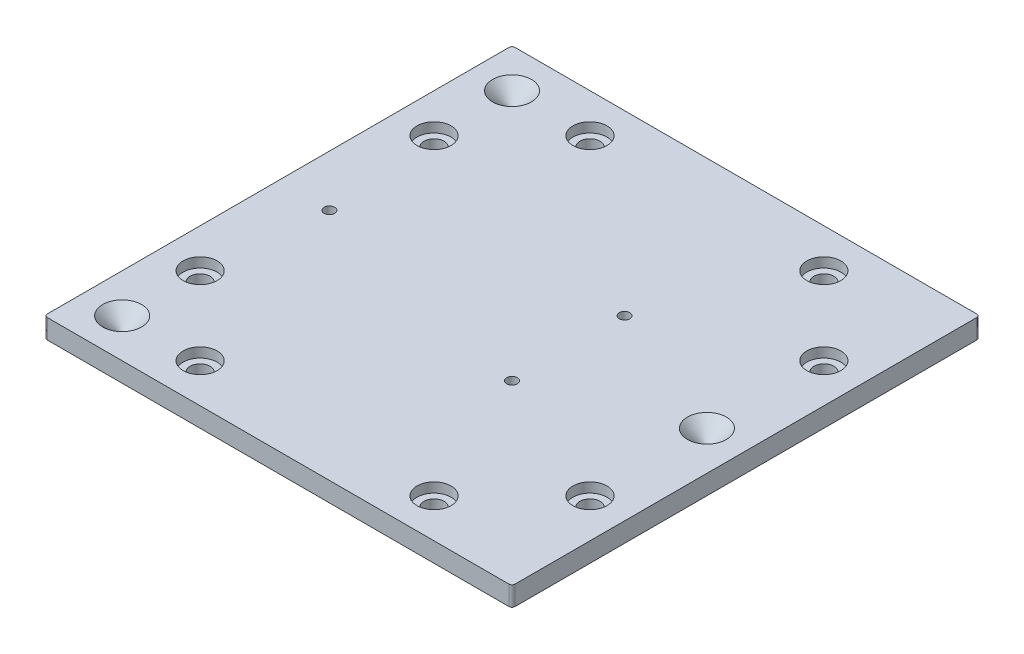
from build123d import *

# Parameters (mm, degrees)
SKETCH1_W                                        = 152.4
SKETCH1_H                                        = 152.4
SKETCH1_R                                        = 3.2639
BOSS_EXTRUDE1_DEPTH                              = 6.35
SKETCH3_R                                        = 6.342
SKETCH4_R                                        = 0.5
SKETCH7_R                                        = 6.342
SKETCH8_R                                        = 0.5
F_8_32_TAPPED_HOLE1_D                            = 3.4544
CBORE_FOR_1_4_SOCKET_HEAD_CAP_SCREW1_D           = 6.5278
CBORE_FOR_1_4_SOCKET_HEAD_CAP_SCREW1_CBORE_D     = 11.1125
CBORE_FOR_1_4_SOCKET_HEAD_CAP_SCREW1_CBORE_DEPTH = 3.175
FILLET1_R                                        = 1


with BuildPart() as part:
    # Sketch1 → Boss-Extrude1 (new body)
    # profile 1 of 13: a face of its own
    with BuildSketch(Plane(origin=(0, 0, 0), x_dir=(1, 0, 0), z_dir=(0, 1, 0))):
        with Locations((76.2, -76.2)):
            Rectangle(SKETCH1_W, SKETCH1_H)
        with Locations((12.7, -38.1)):
            Circle(SKETCH1_R, mode=Mode.SUBTRACT)
        with Locations((12.7, -114.3)):
            Circle(SKETCH1_R, mode=Mode.SUBTRACT)
        with Locations((38.1, -139.7)):
            Circle(SKETCH1_R, mode=Mode.SUBTRACT)
        with Locations((114.3, -139.7)):
            Circle(SKETCH1_R, mode=Mode.SUBTRACT)
        with Locations((139.7, -114.3)):
            Circle(SKETCH1_R, mode=Mode.SUBTRACT)
        with Locations((139.7, -38.1)):
            Circle(SKETCH1_R, mode=Mode.SUBTRACT)
        with Locations((114.3, -12.7)):
            Circle(SKETCH1_R, mode=Mode.SUBTRACT)
        with Locations((38.1, -12.7)):
            Circle(SKETCH1_R, mode=Mode.SUBTRACT)
        with Locations((12.7, -139.7)):
            Circle(SKETCH1_R, mode=Mode.SUBTRACT)
        with Locations((139.7, -139.7)):
            Circle(SKETCH1_R, mode=Mode.SUBTRACT)
        with Locations((139.7, -12.7)):
            Circle(SKETCH1_R, mode=Mode.SUBTRACT)
        with Locations((12.7, -12.7)):
            Circle(SKETCH1_R, mode=Mode.SUBTRACT)
    # profile 2 of 13: a face of its own
    with BuildSketch(Plane(origin=(0, 0, 0), x_dir=(1, 0, 0), z_dir=(0, 1, 0))):
        with Locations((12.7, -12.7)):
            Circle(SKETCH1_R)
    # profile 3 of 13: a face of its own
    with BuildSketch(Plane(origin=(0, 0, 0), x_dir=(1, 0, 0), z_dir=(0, 1, 0))):
        with Locations((139.7, -12.7)):
            Circle(SKETCH1_R)
    # profile 4 of 13: a face of its own
    with BuildSketch(Plane(origin=(0, 0, 0), x_dir=(1, 0, 0), z_dir=(0, 1, 0))):
        with Locations((139.7, -139.7)):
            Circle(SKETCH1_R)
    # profile 5 of 13: a face of its own
    with BuildSketch(Plane(origin=(0, 0, 0), x_dir=(1, 0, 0), z_dir=(0, 1, 0))):
        with Locations((12.7, -139.7)):
            Circle(SKETCH1_R)
    # profile 6 of 13: a face of its own
    with BuildSketch(Plane(origin=(0, 0, 0), x_dir=(1, 0, 0), z_dir=(0, 1, 0))):
        with Locations((38.1, -12.7)):
            Circle(SKETCH1_R)
    # profile 7 of 13: a face of its own
    with BuildSketch(Plane(origin=(0, 0, 0), x_dir=(1, 0, 0), z_dir=(0, 1, 0))):
        with Locations((12.7, -38.1)):
            Circle(SKETCH1_R)
    # profile 8 of 13: a face of its own
    with BuildSketch(Plane(origin=(0, 0, 0), x_dir=(1, 0, 0), z_dir=(0, 1, 0))):
        with Locations((139.7, -38.1)):
            Circle(SKETCH1_R)
    # profile 9 of 13: a face of its own
    with BuildSketch(Plane(origin=(0, 0, 0), x_dir=(1, 0, 0), z_dir=(0, 1, 0))):
        with Locations((114.3, -12.7)):
            Circle(SKETCH1_R)
    # profile 10 of 13: a face of its own
    with BuildSketch(Plane(origin=(0, 0, 0), x_dir=(1, 0, 0), z_dir=(0, 1, 0))):
        with Locations((139.7, -114.3)):
            Circle(SKETCH1_R)
    # profile 11 of 13: a face of its own
    with BuildSketch(Plane(origin=(0, 0, 0), x_dir=(1, 0, 0), z_dir=(0, 1, 0))):
        with Locations((114.3, -139.7)):
            Circle(SKETCH1_R)
    # profile 12 of 13: a face of its own
    with BuildSketch(Plane(origin=(0, 0, 0), x_dir=(1, 0, 0), z_dir=(0, 1, 0))):
        with Locations((12.7, -114.3)):
            Circle(SKETCH1_R)
    # profile 13 of 13: a face of its own
    with BuildSketch(Plane(origin=(0, 0, 0), x_dir=(1, 0, 0), z_dir=(0, 1, 0))):
        with Locations((38.1, -139.7)):
            Circle(SKETCH1_R)
    extrude(amount=BOSS_EXTRUDE1_DEPTH)

    # Sketch3 → Cut-Loft1 section 0
    with BuildSketch(Plane(origin=(0, 6.35, 0), x_dir=(1, 0, 0), z_dir=(0, 1, 0))):
        with Locations((12.7, -12.7)):
            Circle(SKETCH3_R)
    # Sketch4 → Cut-Loft1 section 1
    with BuildSketch(Plane(origin=(0, 0.508, 0), x_dir=(1, 0, 0), z_dir=(0, 1, 0))):
        with Locations((12.7, -12.7)):
            Circle(SKETCH4_R)
    loft(mode=Mode.SUBTRACT)

    # Cut-Loft2: read off the stored shape, not the designer's step
    # Cut-Loft2: loft between two sections, ruled curve by curve
    cut_loft2_from = [
        Edge.make_bspline([(7.199053533, 6.35, 142.856034215), (0.886985103, 6.35, 131.85414128), (11.888878038, 6.35, 125.542072851), (18.200946467, 6.35, 136.543965785), (24.513014897, 6.35, 147.54585872), (13.511121962, 6.35, 153.857927149), (7.199053533, 6.35, 142.856034215)], [0, 0, 0, 0, 0.5, 0.5, 0.5, 1, 1, 1, 1], 3, [1, 0.333333333, 0.333333333, 1, 0.333333333, 0.333333333, 1]),
    ]
    cut_loft2_to = [
        Edge.make_bspline([(12.346224535, 0.508, 140.053331177), (11.639562182, 0.508, 139.345780247), (12.347113112, 0.508, 138.639117893), (13.053775465, 0.508, 139.346668823), (13.760437818, 0.508, 140.054219753), (13.052886888, 0.508, 140.760882107), (12.346224535, 0.508, 140.053331177)], [0, 0, 0, 0, 0.5, 0.5, 0.5, 1, 1, 1, 1], 3, [1, 0.333333333, 0.333333333, 1, 0.333333333, 0.333333333, 1]),
    ]
    cut_loft2 = Solid(Shell([*[Face.make_surface_from_curves(cut_loft2_from[k], cut_loft2_to[k]) for k in range(1)], Face(Wire(cut_loft2_from)), Face(Wire(cut_loft2_to))]))
    add(cut_loft2, mode=Mode.SUBTRACT)

    # Sketch7 → Cut-Loft4 section 0
    with BuildSketch(Plane(origin=(0, 6.35, 0), x_dir=(1, 0, 0), z_dir=(0, 1, 0))):
        with Locations((139.7, -76.2)):
            Circle(SKETCH7_R)
    # Sketch8 → Cut-Loft4 section 1
    with BuildSketch(Plane(origin=(0, 0.508, -1.35), x_dir=(1, 0, 0), z_dir=(0, -1, 0))):
        with Locations((139.7, 77.55)):
            Circle(SKETCH8_R)
    loft(mode=Mode.SUBTRACT)

    # #8-32 Tapped Hole1 (through all)
    with Locations(Plane(origin=(16.7, 0, 76.2), x_dir=(0, 0, -1), z_dir=(0, -1, 0))):
        with Locations((0, 0), (18.3382, 77.8382), (-18.3382, 77.8382)):
            Hole(F_8_32_TAPPED_HOLE1_D / 2)

    # CBORE for 1/4 Socket Head Cap Screw1 (through all)
    with Locations(Plane(origin=(38.1, 6.35, 12.7), x_dir=(0, 0, 1), z_dir=(0, 1, 0))):
        with Locations((0, 0), (25.4, -25.4), (0, 76.2), (25.4, 101.6), (101.6, 101.6), (127, 76.2), (127, 0), (101.6, -25.4)):
            CounterBoreHole(CBORE_FOR_1_4_SOCKET_HEAD_CAP_SCREW1_D / 2, CBORE_FOR_1_4_SOCKET_HEAD_CAP_SCREW1_CBORE_D / 2, CBORE_FOR_1_4_SOCKET_HEAD_CAP_SCREW1_CBORE_DEPTH)

    # Fillet1
    fillet1_edges = [part.edges().sort_by_distance(p)[0] for p in [
        (152.4, 3.175, 152.4),
        (0, 3.175, 152.4),
        (0, 3.175, 0),
        (152.4, 3.175, 0),
    ]]
    fillet(fillet1_edges, radius=FILLET1_R)


solid = part.part
